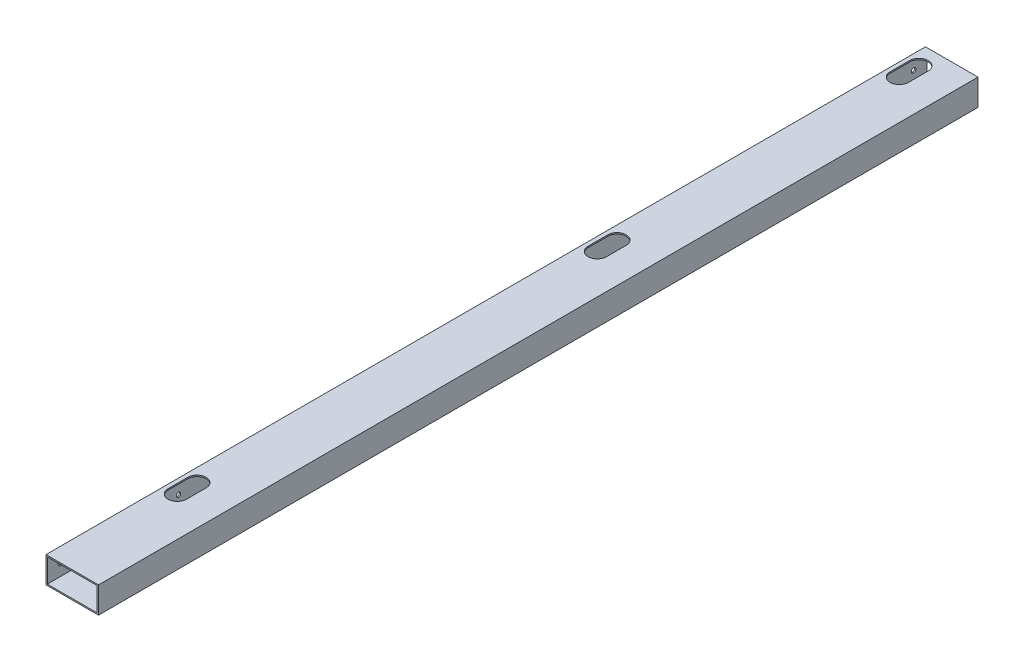
from build123d import *

# Parameters (mm, degrees)
SKETCH_1_W             = 40
SKETCH_1_H             = 20
SKETCH_1_W_2           = 38
SKETCH_1_H_2           = 18
EXTRUDE_1_DEPTH        = 670
SKETCH_4_R             = 1.75
CUT_EXTRUDE_2_DEPTH    = 1.5
SKETCH_8_R             = 1.65
CUT_EXTRUDE_3_DEPTH    = 5
SKETCH_9_R             = 1.6
CUT_EXTRUDE_4_DEPTH    = 10
CUT_EXTRUDE_5_DEPTH    = 10
PATTERN_LINEAR_1_COUNT = 2
PATTERN_LINEAR_1_PITCH = 230


with BuildPart() as part:
    # 草图1 → 拉伸-薄壁1 (new body)
    with BuildSketch(Plane.XY):
        with Locations((20, -10)):
            Rectangle(SKETCH_1_W, SKETCH_1_H)
        with Locations((20, -10)):
            Rectangle(SKETCH_1_W_2, SKETCH_1_H_2, mode=Mode.SUBTRACT)
    extrude(amount=EXTRUDE_1_DEPTH)

    # 草图4 → 切除-拉伸2 (cut)
    with BuildSketch(Plane.ZY):
        with Locations((659.996387591, -10)):
            Circle(SKETCH_4_R)
        with Locations((10, -10.000000002)):
            Circle(SKETCH_4_R)
    extrude(amount=-CUT_EXTRUDE_2_DEPTH, mode=Mode.SUBTRACT)

    # 草图8 → 切除-拉伸3 (cut)
    with BuildSketch(Plane.ZY):
        with Locations((55, -10)):
            Circle(SKETCH_8_R)
        with Locations((265, -10)):
            Circle(SKETCH_8_R)
    extrude(amount=-CUT_EXTRUDE_3_DEPTH, mode=Mode.SUBTRACT)

    # 草图9 → 切除-拉伸4 (cut)
    with BuildSketch(Plane.ZY):
        with Locations((570, -10)):
            Circle(SKETCH_9_R)
    extrude(amount=-CUT_EXTRUDE_4_DEPTH, mode=Mode.SUBTRACT)

    # 草图10 → 切除-拉伸5 (cut)
    with BuildSketch(Plane(origin=(0, 0, 0), x_dir=(1, 0, 0), z_dir=(0, 1, 0))):
        with BuildLine():
            Line((3, -580), (3, -565))
            ThreePointArc((3, -565), (10, -558), (17, -565))
            Line((17, -565), (17, -580))
            ThreePointArc((17, -580), (10, -587), (3, -580))
        make_face()
        with BuildLine():
            Line((3, -30), (3, -15))
            ThreePointArc((3, -15), (10, -8), (17, -15))
            Line((17, -15), (17, -30))
            ThreePointArc((17, -30), (10, -37), (3, -30))
        make_face()
    cut_extrude_5 = extrude(amount=-CUT_EXTRUDE_5_DEPTH, mode=Mode.SUBTRACT)

    # 阵列(线性)1: 切除-拉伸5 ×2
    with Locations(*[(0, 0, i * PATTERN_LINEAR_1_PITCH) for i in range(1, PATTERN_LINEAR_1_COUNT)]):
        add(cut_extrude_5, mode=Mode.SUBTRACT)


solid = part.part
